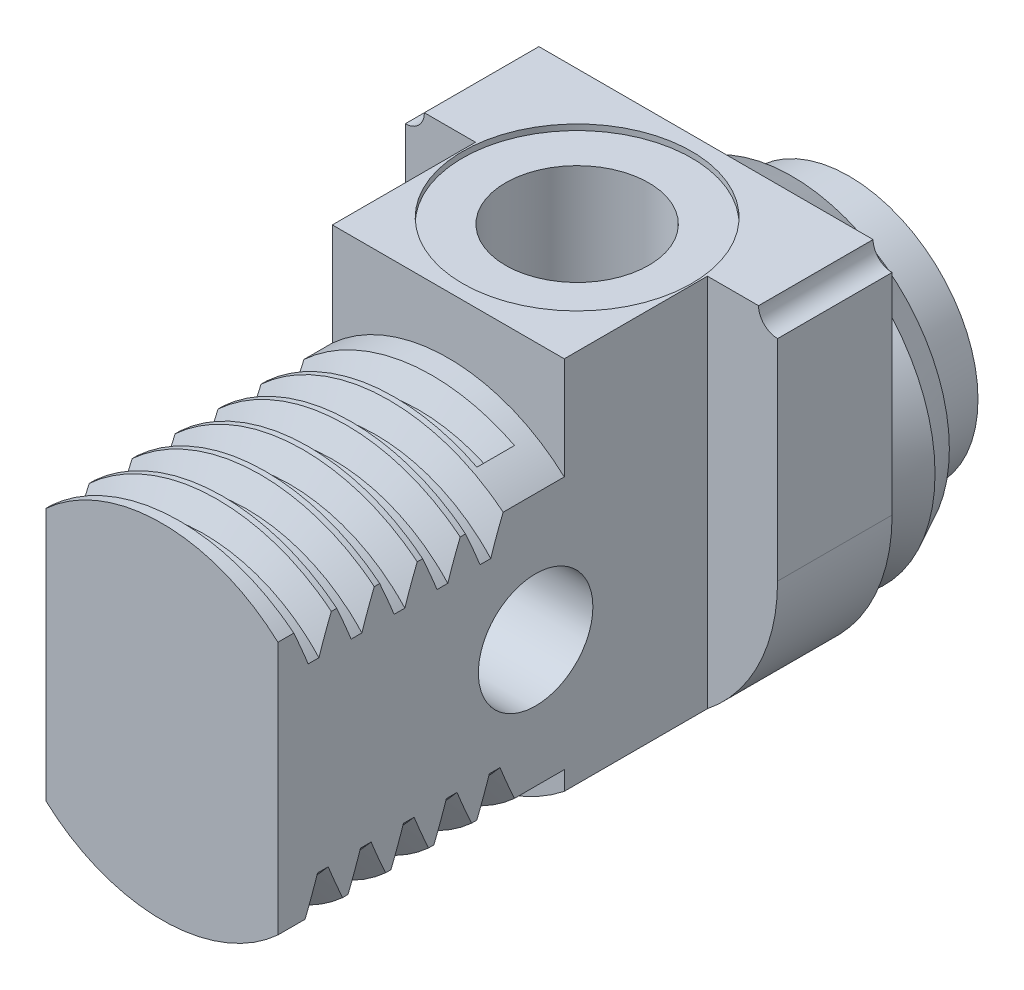
from build123d import *

# Parameters (mm, degrees)
SKETCH1_R                = 5.5
SKETCH2_R                = 6
SKETCH4_R                = 6
SKETCH3_R                = 5
SKETCH5_R                = 6.5
BOSS_EXTRUDE1_DEPTH      = 9
BOSS_EXTRUDE2_REACH      = 21.912
BOSS_EXTRUDE2_END_RADIUS = 6.5
SKETCH6_W                = 13
SKETCH6_H                = 9
CUT_EXTRUDE1_DEPTH       = 9
SKETCH8_R                = 6
BOSS_EXTRUDE3_DEPTH      = 10
THREAD1_PITCH            = 1.5
SKETCH16_R               = 4
CUT_EXTRUDE4_DEPTH       = 0.2
SKETCH17_R               = 2.5
CUT_EXTRUDE7_DEPTH       = 10
CUT_EXTRUDE18_REACH      = 29.139
SKETCH19_W               = 2.45
SKETCH19_H               = 15.799371819
CUT_EXTRUDE19_REACH      = 27.677
SKETCH20_R               = 2
SKETCH21_R               = 4.5
BOSS_EXTRUDE4_DEPTH      = 2


with BuildPart() as part:
    # Sketch1 → Loft1 section 0
    with BuildSketch(Plane.XY):
        Circle(SKETCH1_R)
    # Sketch2 → Loft1 section 1
    with BuildSketch(Plane.XY.offset(1)):
        Circle(SKETCH2_R)
    loft()

    # Sketch4 → Loft3 section 0
    with BuildSketch(Plane.XY.offset(1)):
        Circle(SKETCH4_R)
    # Sketch3 → Loft3 section 1
    with BuildSketch(Plane.XY.offset(3)):
        Circle(SKETCH3_R)
    loft()

    # Sketch5 → Boss-Extrude1 (add)
    with BuildSketch(Plane.XY.offset(3)):
        Circle(SKETCH5_R)
    extrude(amount=BOSS_EXTRUDE1_DEPTH)

    # Boss-Extrude2: up to this cylinder (the profile starts outside it)
    boss_extrude2_end = Plane(origin=(0, 0, 7.5), z_dir=(0, 0, -1)) * Cylinder(BOSS_EXTRUDE2_END_RADIUS, 57.824, mode=Mode.PRIVATE)
    # Sketch6 → Boss-Extrude2 (add, up to the surface)
    with BuildSketch(Plane(origin=(0, 8, 0), x_dir=(1, 0, 0), z_dir=(0, 1, 0)), mode=Mode.PRIVATE) as boss_extrude2_sk1:
        with Locations((0, -7.5)):
            Rectangle(SKETCH6_W, SKETCH6_H)
    boss_extrude2_tool1 = extrude(boss_extrude2_sk1.sketch, amount=-BOSS_EXTRUDE2_REACH, mode=Mode.PRIVATE) - boss_extrude2_end
    add(boss_extrude2_tool1.solids().sort_by_distance((0, 8, 7.5))[0])

    # Sketch7 → Cut-Extrude1 (cut)
    with BuildSketch(Plane(origin=(0, 0, 3), x_dir=(-1, 0, 0), z_dir=(0, 0, -1))):
        with BuildLine():
            Line((-6.5, 8), (-5.835999771, 8))
            ThreePointArc((-5.835999771, 8), (-6.030480936, 7.530480936), (-6.5, 7.335999771))
            Line((-6.5, 7.335999771), (-6.5, 8))
        make_face()
        with BuildLine():
            Line((5.835999771, 8), (6.5, 8))
            Line((6.5, 8), (6.5, 7.335999771))
            ThreePointArc((6.5, 7.335999771), (6.030480936, 7.530480936), (5.835999771, 8))
        make_face()
    extrude(amount=-CUT_EXTRUDE1_DEPTH, mode=Mode.SUBTRACT)

    # Sketch8 → Boss-Extrude3 (add)
    with BuildSketch(Plane.XY.offset(12)):
        Circle(SKETCH8_R)
    extrude(amount=BOSS_EXTRUDE3_DEPTH)

    # Thread1: arcs per turn and ends read off the stored shape
    # Thread1: the profile of Thread Profile1 profile screwed along a right-hand helix through 5.333333 turns, 8 arcs to a turn; built about Z, then put on its axis
    thread1_z = Axis((0, 0, 0), (0, 0, 1))
    thread1_corners = [(6.0003, 0, -0.000173205), (6.0003, 0, 1.312673201), (5.188101188, 0, 0.843749998), (5.188101188, 0, 0.468749998)]
    with BuildLine(mode=Mode.PRIVATE) as thread1_profile:
        Line(thread1_corners[0], thread1_corners[1])
        Line(thread1_corners[1], thread1_corners[2])
        Line(thread1_corners[2], thread1_corners[3])
        Line(thread1_corners[3], thread1_corners[0])
    thread1_cap = Face(thread1_profile.wire())
    thread1_turn_angles = [0, 22.5, 45, 67.5, 90, 112.5, 135, 157.5, 180, 202.5, 225, 247.5, 270, 292.5, 315, 337.5, 360]
    thread1_turn_weights = [1, 0.9238795325112867, 1, 0.9238795325112867, 1, 0.9238795325112867, 1, 0.9238795325112867, 1, 0.9238795325112867, 1, 0.9238795325112867, 1, 0.9238795325112867, 1, 0.9238795325112867, 1]
    thread1_turn_rails = [Edge.make_bspline([Vector(p[0], p[1], 0).rotate(thread1_z, thread1_turn_angles[k]) / thread1_turn_weights[k] + Vector(0, 0, p[2] + THREAD1_PITCH * thread1_turn_angles[k] / 360) for k in range(17)], [0, 0, 0, 1, 1, 2, 2, 3, 3, 4, 4, 5, 5, 6, 6, 7, 7, 8, 8, 8], 2, thread1_turn_weights) for p in thread1_corners]
    thread1_turn_sides = [Face.make_surface_from_curves(thread1_turn_rails[p[0]], thread1_turn_rails[p[1]]) for p in [(0, 1), (1, 2), (2, 3), (3, 0)]]
    thread1_last_angles = [1800, 1822.5, 1845, 1867.5, 1890, 1905, 1920]
    thread1_last_weights = [1, 0.9238795325112867, 1, 0.9238795325112867, 1, 0.9659258262890683, 1]
    thread1_last_rails = [Edge.make_bspline([Vector(p[0], p[1], 0).rotate(thread1_z, thread1_last_angles[k]) / thread1_last_weights[k] + Vector(0, 0, p[2] + THREAD1_PITCH * thread1_last_angles[k] / 360) for k in range(7)], [0, 0, 0, 1, 1, 2, 2, 3, 3, 3], 2, thread1_last_weights) for p in thread1_corners]
    thread1_last_sides = [Face.make_surface_from_curves(thread1_last_rails[p[0]], thread1_last_rails[p[1]]) for p in [(0, 1), (1, 2), (2, 3), (3, 0)]]
    thread1 = Plane(origin=(0, 0, 22), x_dir=(-1, 0, 0), z_dir=(0, 0, -1)) * Solid(Shell([*[p.moved(Location((0, 0, THREAD1_PITCH * i))) for i in range(5) for p in thread1_turn_sides], *thread1_last_sides, thread1_cap, thread1_cap.rotate(thread1_z, 1920).moved(Location((0, 0, THREAD1_PITCH * 1920 / 360)))]))
    add(thread1, mode=Mode.SUBTRACT)

    # Sketch16 → Cut-Extrude4 (cut)
    with BuildSketch(Plane(origin=(0, 8, 0), x_dir=(1, 0, 0), z_dir=(0, 1, 0))):
        with Locations(Location((0, -7.5, 0), (0, 0, 270))):
            Circle(SKETCH16_R)
    extrude(amount=-CUT_EXTRUDE4_DEPTH, mode=Mode.SUBTRACT)

    # Sketch17 → Cut-Extrude7 (cut)
    with BuildSketch(Plane(origin=(0, 7.8, 0), x_dir=(1, 0, 0), z_dir=(0, 1, 0))):
        with Locations(Location((0, -7.5, 0), (0, 0, 270))):
            Circle(SKETCH17_R)
    extrude(amount=-CUT_EXTRUDE7_DEPTH, mode=Mode.SUBTRACT)

    # Sketch19 → Cut-Extrude18 (cut, up to next)
    with BuildSketch(Plane(origin=(0, 8, 0), x_dir=(1, 0, 0), z_dir=(0, 1, 0)), mode=Mode.PRIVATE) as cut_extrude18_sk1:
        with Locations((-5.275, -14.89968591)):
            Rectangle(SKETCH19_W, SKETCH19_H)
    cut_extrude18_tool1 = extrude(cut_extrude18_sk1.sketch, amount=-CUT_EXTRUDE18_REACH, mode=Mode.PRIVATE) & part.part
    # Sketch19 → Cut-Extrude18 (cut, up to next)
    with BuildSketch(Plane(origin=(0, 8, 0), x_dir=(1, 0, 0), z_dir=(0, 1, 0)), mode=Mode.PRIVATE) as cut_extrude18_sk2:
        with Locations((5.275, -14.89968591)):
            Rectangle(SKETCH19_W, SKETCH19_H)
    cut_extrude18_tool2 = extrude(cut_extrude18_sk2.sketch, amount=-CUT_EXTRUDE18_REACH, mode=Mode.PRIVATE) & part.part
    add(cut_extrude18_tool1.solids().sort_by_distance((-5.275, 8, 14.899686))[0], mode=Mode.SUBTRACT)
    add(cut_extrude18_tool2.solids().sort_by_distance((5.275, 8, 14.899686))[0], mode=Mode.SUBTRACT)

    # Sketch20 → Cut-Extrude19 (cut, up to next)
    with BuildSketch(Plane(origin=(4.05, 0, 0), x_dir=(0, 0, -1), z_dir=(1, 0, 0)), mode=Mode.PRIVATE) as cut_extrude19_sk1:
        with Locations((-13, 0)):
            Circle(SKETCH20_R)
    cut_extrude19_tool1 = extrude(cut_extrude19_sk1.sketch, amount=-CUT_EXTRUDE19_REACH, mode=Mode.PRIVATE) & part.part
    add(cut_extrude19_tool1.solids().sort_by_distance((4.05, 0, 13))[0], mode=Mode.SUBTRACT)

    # Sketch21 → Boss-Extrude4 (add)
    with BuildSketch(Plane(origin=(0, 0, 0), x_dir=(-1, 0, 0), z_dir=(0, 0, -1))):
        Circle(SKETCH21_R)
    extrude(amount=BOSS_EXTRUDE4_DEPTH)


solid = part.part
